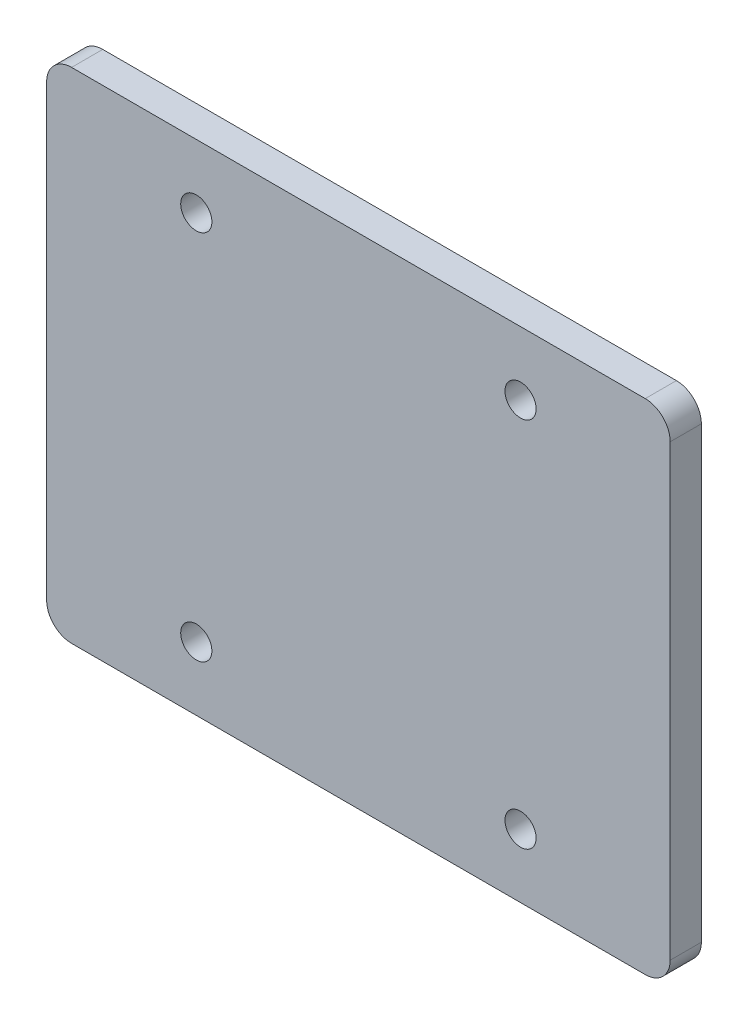
from build123d import *

# Parameters (mm, degrees)
SKETCH1_W           = 63.5
SKETCH1_H           = 50.8
BOSS_EXTRUDE1_DEPTH = 3.175
FILLET1_R           = 2.54
CUT_EXTRUDE1_REACH  = 83.382
SKETCH4_R           = 1.5875


with BuildPart() as part:
    # Sketch1 → Boss-Extrude1 (new body)
    with BuildSketch(Plane.XY):
        with Locations((31.75, 25.4)):
            Rectangle(SKETCH1_W, SKETCH1_H)
    extrude(amount=BOSS_EXTRUDE1_DEPTH)

    # Fillet1
    fillet1_edges = [part.edges().sort_by_distance(p)[0] for p in [
        (0, 0, 1.5875),
        (63.5, 0, 1.5875),
        (0, 50.8, 1.5875),
        (63.5, 50.8, 1.5875),
    ]]
    fillet(fillet1_edges, radius=FILLET1_R)

    # Sketch4 → Cut-Extrude1 (cut, up to next)
    with BuildSketch(Plane.XY.offset(3.175), mode=Mode.PRIVATE) as cut_extrude1_sk1:
        with Locations((15.24, 6.477)):
            Circle(SKETCH4_R)
    cut_extrude1_tool1 = extrude(cut_extrude1_sk1.sketch, amount=-CUT_EXTRUDE1_REACH, mode=Mode.PRIVATE) & part.part
    # Sketch4 → Cut-Extrude1 (cut, up to next)
    with BuildSketch(Plane.XY.offset(3.175), mode=Mode.PRIVATE) as cut_extrude1_sk2:
        with Locations((15.24, 44.323)):
            Circle(SKETCH4_R)
    cut_extrude1_tool2 = extrude(cut_extrude1_sk2.sketch, amount=-CUT_EXTRUDE1_REACH, mode=Mode.PRIVATE) & part.part
    # Sketch4 → Cut-Extrude1 (cut, up to next)
    with BuildSketch(Plane.XY.offset(3.175), mode=Mode.PRIVATE) as cut_extrude1_sk3:
        with Locations((48.26, 44.323)):
            Circle(SKETCH4_R)
    cut_extrude1_tool3 = extrude(cut_extrude1_sk3.sketch, amount=-CUT_EXTRUDE1_REACH, mode=Mode.PRIVATE) & part.part
    # Sketch4 → Cut-Extrude1 (cut, up to next)
    with BuildSketch(Plane.XY.offset(3.175), mode=Mode.PRIVATE) as cut_extrude1_sk4:
        with Locations((48.26, 6.477)):
            Circle(SKETCH4_R)
    cut_extrude1_tool4 = extrude(cut_extrude1_sk4.sketch, amount=-CUT_EXTRUDE1_REACH, mode=Mode.PRIVATE) & part.part
    add(cut_extrude1_tool1.solids().sort_by_distance((15.24, 6.477, 3.175))[0], mode=Mode.SUBTRACT)
    add(cut_extrude1_tool2.solids().sort_by_distance((15.24, 44.323, 3.175))[0], mode=Mode.SUBTRACT)
    add(cut_extrude1_tool3.solids().sort_by_distance((48.26, 44.323, 3.175))[0], mode=Mode.SUBTRACT)
    add(cut_extrude1_tool4.solids().sort_by_distance((48.26, 6.477, 3.175))[0], mode=Mode.SUBTRACT)


solid = part.part
